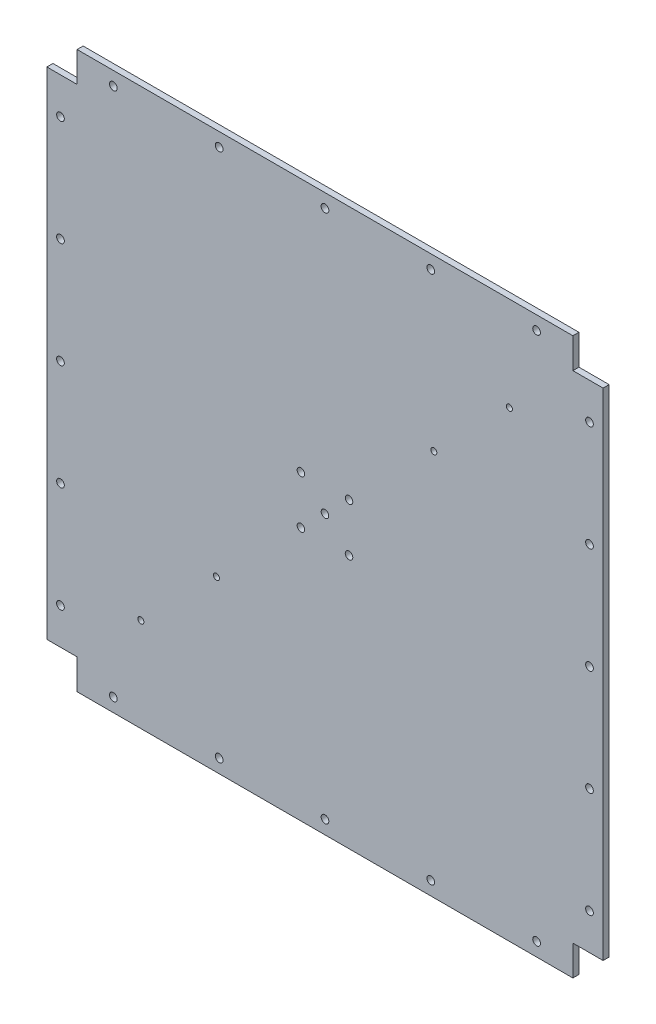
from build123d import *

# Parameters (mm, degrees)
SKETCH_1_W          = 368
SKETCH_1_H          = 368
EXTRUDE_1_DEPTH     = 4
SKETCH_3_R          = 2.55
CUT_EXTRUDE_2_DEPTH = 261.246037434
SKETCH_4_W          = 20
SKETCH_4_H          = 20
CUT_EXTRUDE_3_DEPTH = 261.246037434
SKETCH_5_R          = 2.5
CUT_EXTRUDE_6_DEPTH = 10
SKETCH_6_R          = 2
CUT_EXTRUDE_7_DEPTH = 10


with BuildPart() as part:
    # 草图1 → 凸台-拉伸1 (new body)
    with BuildSketch(Plane.XY):
        Rectangle(SKETCH_1_W, SKETCH_1_H)
    extrude(amount=EXTRUDE_1_DEPTH)

    # 草图3 → 切除-拉伸2 (cut, through all)
    with BuildSketch(Plane.XY.offset(4)):
        with Locations((0, -175)):
            Circle(SKETCH_3_R)
        with Locations((70, -175)):
            Circle(SKETCH_3_R)
        with Locations((140, -175)):
            Circle(SKETCH_3_R)
        with Locations((-70, -175)):
            Circle(SKETCH_3_R)
        with Locations((-140, -175)):
            Circle(SKETCH_3_R)
        with Locations((-175, 140)):
            Circle(SKETCH_3_R)
        with Locations((-175, 70)):
            Circle(SKETCH_3_R)
        with Locations((-175, -70)):
            Circle(SKETCH_3_R)
        with Locations((-175, -140)):
            Circle(SKETCH_3_R)
        with Locations((-175, 0)):
            Circle(SKETCH_3_R)
        with Locations((140, 175)):
            Circle(SKETCH_3_R)
        with Locations((70, 175)):
            Circle(SKETCH_3_R)
        with Locations((-70, 175)):
            Circle(SKETCH_3_R)
        with Locations((-140, 175)):
            Circle(SKETCH_3_R)
        with Locations((0, 175)):
            Circle(SKETCH_3_R)
        with Locations((175, -140)):
            Circle(SKETCH_3_R)
        with Locations((175, -70)):
            Circle(SKETCH_3_R)
        with Locations((175, 70)):
            Circle(SKETCH_3_R)
        with Locations((175, 140)):
            Circle(SKETCH_3_R)
        with Locations((175, 0)):
            Circle(SKETCH_3_R)
    extrude(amount=-CUT_EXTRUDE_2_DEPTH, mode=Mode.SUBTRACT)

    # 草图4 → 切除-拉伸3 (cut, through all)
    with BuildSketch(Plane.XY.offset(4)):
        with Locations((-174, 174)):
            Rectangle(SKETCH_4_W, SKETCH_4_H)
        with Locations((-174, -174)):
            Rectangle(SKETCH_4_W, SKETCH_4_H)
        with Locations((174, 174)):
            Rectangle(SKETCH_4_W, SKETCH_4_H)
        with Locations((174, -174)):
            Rectangle(SKETCH_4_W, SKETCH_4_H)
    extrude(amount=-CUT_EXTRUDE_3_DEPTH, mode=Mode.SUBTRACT)

    # 草图5 → 切除-拉伸6 (cut)
    with BuildSketch(Plane.XY.offset(4)):
        Circle(SKETCH_5_R)
        with Locations((-15.909902577, 15.909902577)):
            Circle(SKETCH_5_R)
        with Locations((15.909902577, 15.909902577)):
            Circle(SKETCH_5_R)
        with Locations((15.909902577, -15.909902577)):
            Circle(SKETCH_5_R)
        with Locations((-15.909902577, -15.909902577)):
            Circle(SKETCH_5_R)
    extrude(amount=-CUT_EXTRUDE_6_DEPTH, mode=Mode.SUBTRACT)

    # 草图6 → 切除-拉伸7 (cut)
    with BuildSketch(Plane(origin=(0, 0, 0), x_dir=(-1, 0, 0), z_dir=(0, 0, -1))):
        with Locations((121.8, -122)):
            Circle(SKETCH_6_R)
        with Locations((71.8, -72)):
            Circle(SKETCH_6_R)
        with Locations((-122, 121.8)):
            Circle(SKETCH_6_R)
        with Locations((-72, 71.8)):
            Circle(SKETCH_6_R)
    extrude(amount=-CUT_EXTRUDE_7_DEPTH, mode=Mode.SUBTRACT)


solid = part.part
